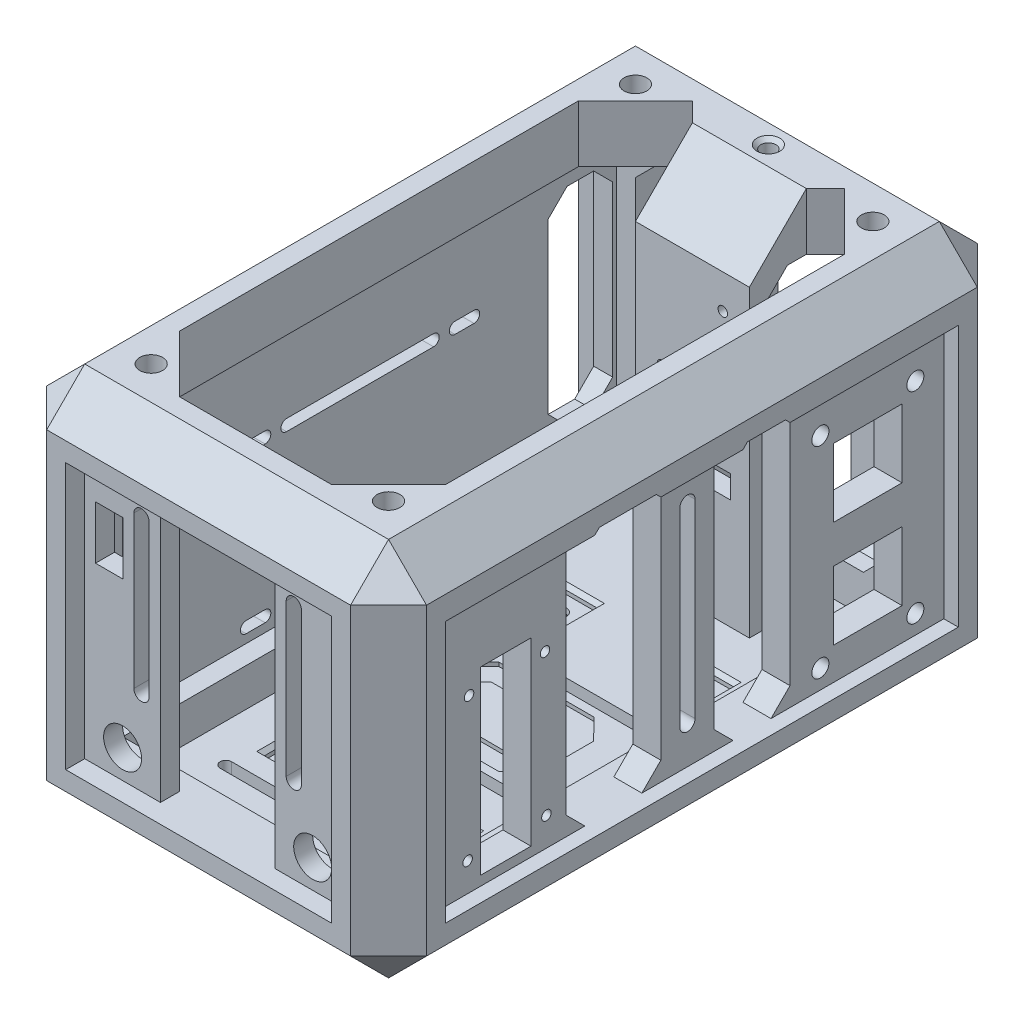
from build123d import *

# Parameters (mm, degrees)
SKETCH1_W                                      = 100
SKETCH1_H                                      = 100
MAIN_CUBE_DEPTH                                = 165
MAIN_CUBE_CHAMFER_SIZE                         = 10
SKETCH2_W                                      = 135
SKETCH2_H                                      = 70
MAIN_CUBE_HOLLOW_OUT_1_DEPTH                   = 100
MAIN_CUBE_HOLLOW_OUT_2_REACH                   = 219.313
SKETCH3_W                                      = 70
SKETCH3_H                                      = 70
SKETCH4_W                                      = 70
SKETCH4_H                                      = 135
MAIN_CUBE_HOLLOW_OUT_3_DEPTH                   = 100
SKETCH5_W                                      = 70
SKETCH5_H                                      = 135
BOTTOM_DEPTH                                   = 5
SKETCH6_W                                      = 70
SKETCH6_H                                      = 5
CAMERA_AND_TEMP_SENSOR_WALL_DEPTH              = 70
SKETCH7_R                                      = 5
SKETCH7_W                                      = 7.25
SKETCH7_H                                      = 14
CAMERA_AND_EXT_TEMP_SENSOR_THROUGH_HOLE_DEPTH  = 5
SKETCH8_W                                      = 5
SKETCH8_H                                      = 135
ANTENNA_AND_BATTERY_BRACKET_DEPTH              = 70
TOP_CHAMFER_1_SIZE                             = 5
SKETCH9_W                                      = 17
SKETCH9_H                                      = 54.5
ANTENNA_AND_BATTERY_ZIP_TIE_HOLES_DEPTH        = 5
ANTENNA_AND_BATTERY_WIRE_PASS_THROUGHS_SIZE    = 5
TOP_START                                      = -151
TOP_CHAMFER_2_DEPTH                            = 38.5
TOP_START_2                                    = -52.5
TOP_CHAMFER_2_2_DEPTH                          = 38.5
TOP_START_3                                    = -107.5
TOP_CHAMFER_2_3_DEPTH                          = 5.658057903
TOP_START_4                                    = -63.158057903
TOP_CHAMFER_2_4_DEPTH                          = 5.658057903
TOP_START_5                                    = 0.5281
TOP_CHAMFER_2_5_DEPTH                          = 13.4719
TOP_CHAMFER_2_6_DEPTH                          = 137
SKETCH10_W                                     = 7.381360458
SKETCH10_H                                     = 135
SD_CARD_BOARD_AND_PERF_BOARD_WALL_DEPTH        = 70
SKETCH11_R                                     = 1.25
SKETCH11_R_2                                   = 2.25
SKETCH11_W                                     = 13.305927988
SKETCH11_H                                     = 47.5
SKETCH11_W_2                                   = 18
SKETCH11_H_2                                   = 18
SKETCH11_W_3                                   = 25
SKETCH11_H_3                                   = 70
SKETCH11_W_4                                   = 20
SD_CARD_BOARD_AND_PERF_BOARD_THROUGH_HOL_DEPTH = 7.381360457
TOP_CHAMFER_3_SIZE                             = 5
SKETCH13_W                                     = 30
SKETCH13_H                                     = 20
PRESSURE_SENSOR_BRACKET_1_DEPTH                = 10
SKETCH14_W                                     = 30
SKETCH14_H                                     = 5
PRESSURE_SENSOR_BRACKET_2_DEPTH                = 85
SKETCH16_W                                     = 30
SKETCH16_H                                     = 15
PRESSURE_SENSOR_BRACKET_3_DEPTH                = 15
SKETCH17_W                                     = 5
SKETCH17_H                                     = 15
PRESSURE_SENSOR_BRACKET_4_DEPTH                = 20
TOP_CHAMFER_4_SIZE                             = 5
PRESSURE_SENSOR_BRACKET_CHAMFER_SIZE           = 5
TOP_CHAMFER_5_SIZE                             = 10
BOTTOM_CHAMFER_1_SIZE                          = 10
WIRE_START                                     = -30
SKETCH18_R                                     = 5
WIRE_MANAGEMENT_HOLE_DEPTH                     = 30
SKETCH19_R                                     = 1.25
SKETCH19_W                                     = 20
SKETCH19_H                                     = 6
PRESSURE_SENSOR_THROUGH_HOLE_DEPTH             = 5
SKETCH20_W                                     = 7.5
SKETCH20_H                                     = 5.695459185
BOSS_EXTRUDE13_DEPTH                           = 70
BOSS_EXTRUDE14_DEPTH                           = 5.695459185
CHAMFER10_SIZE                                 = 5
CHAMFER11_SIZE                                 = 5
CHAMFER12_SIZE                                 = 5
CHAMFER14_SIZE                                 = 15
CUT_EXTRUDE9_START                             = -15
SKETCH23_R                                     = 2
CUT_EXTRUDE9_DEPTH                             = 100
CHAMFER15_SIZE                                 = 1
SKETCH24_W                                     = 9.5
SKETCH24_H                                     = 9.5
SKETCH24_H_2                                   = 9.25
CUT_EXTRUDE10_DEPTH                            = 2
CHAMFER16_SIZE                                 = 1
SKETCH25_R                                     = 2
CUT_EXTRUDE11_DEPTH                            = 3
SKETCH27_R                                     = 2
CUT_EXTRUDE12_DEPTH                            = 3
SKETCH26_R                                     = 2
CUT_EXTRUDE13_DEPTH                            = 3
CHAMFER17_SIZE                                 = 1.5
CHAMFER18_SIZE                                 = 5
CHAMFER19_SIZE                                 = 5
CUT_EXTRUDE14_DEPTH                            = 5
SKETCH29_R                                     = 3
BOSS_EXTRUDE16_DEPTH                           = 15
CUT_EXTRUDE15_DEPTH                            = 5
CUT_EXTRUDE16_DEPTH                            = 1


with BuildPart() as part:
    # Sketch1 → Main Cube (new body)
    with BuildSketch(Plane.XY):
        with Locations((50, 50)):
            Rectangle(SKETCH1_W, SKETCH1_H)
    extrude(amount=-MAIN_CUBE_DEPTH)

    # Main Cube Chamfer
    main_cube_chamfer_edges = [part.edges().sort_by_distance(p)[0] for p in [
        (100, 50, -165),
        (50, 100, -165),
        (0, 50, -165),
        (50, 100, 0),
        (100, 50, 0),
        (50, 0, 0),
        (0, 50, 0),
        (0, 100, -82.5),
        (100, 100, -82.5),
        (100, 0, -82.5),
        (0, 0, -82.5),
        (50, 0, -165),
    ]]
    chamfer(main_cube_chamfer_edges, length=MAIN_CUBE_CHAMFER_SIZE)

    # Sketch2 → Main Cube Hollow Out 1 (cut)
    with BuildSketch(Plane.ZY):
        with Locations((-82.5, 50)):
            Rectangle(SKETCH2_W, SKETCH2_H)
    extrude(amount=-MAIN_CUBE_HOLLOW_OUT_1_DEPTH, mode=Mode.SUBTRACT)

    # Main Cube Hollow Out 2: up to this face of the body (flat: up to its plane)
    main_cube_hollow_out_2_end = Plane(part.part.faces().sort_by_distance((50, 50, 0))[0])
    # Sketch3 → Main Cube Hollow Out 2 (cut, up to the picked face)
    with BuildSketch(Plane(origin=(0, 0, -165), x_dir=(-1, 0, 0), z_dir=(0, 0, -1)), mode=Mode.PRIVATE) as main_cube_hollow_out_2_sk1:
        with Locations((-50, 50)):
            Rectangle(SKETCH3_W, SKETCH3_H)
    main_cube_hollow_out_2_tool1 = split(extrude(main_cube_hollow_out_2_sk1.sketch, amount=-MAIN_CUBE_HOLLOW_OUT_2_REACH, mode=Mode.PRIVATE), bisect_by=main_cube_hollow_out_2_end, keep=Keep.BOTH, mode=Mode.PRIVATE)
    add(main_cube_hollow_out_2_tool1.solids().sort_by(Axis((50, 50, -165), (0, 0, 1)))[0], mode=Mode.SUBTRACT)

    # Sketch4 → Main Cube Hollow Out 3 (cut)
    with BuildSketch(Plane(origin=(0, 100, 0), x_dir=(1, 0, 0), z_dir=(0, 1, 0))):
        with Locations((50, 82.5)):
            Rectangle(SKETCH4_W, SKETCH4_H)
    extrude(amount=-MAIN_CUBE_HOLLOW_OUT_3_DEPTH, mode=Mode.SUBTRACT)

    # Sketch5 → Bottom (add)
    with BuildSketch(Plane.XZ):
        with Locations((50, -82.5)):
            Rectangle(SKETCH5_W, SKETCH5_H)
    extrude(amount=-BOTTOM_DEPTH)

    # Sketch6 → Camera and Temp Sensor Wall (add)
    with BuildSketch(Plane(origin=(0, 15, 0), x_dir=(1, 0, 0), z_dir=(0, 1, 0))):
        with Locations((50, 7.5)):
            Rectangle(SKETCH6_W, SKETCH6_H)
    extrude(amount=CAMERA_AND_TEMP_SENSOR_WALL_DEPTH)

    # Sketch7 → Camera and Ext. Temp Sensor Through Holes (cut)
    with BuildSketch(Plane.XY.offset(-5)):
        with Locations((24.975, 22.5)):
            Circle(SKETCH7_R)
        with Locations((75.025, 22.5)):
            Circle(SKETCH7_R)
        Polygon((34.95, 30), (34.95, 85), (65.05, 85), (65.05, 30), (65.05, 15), (34.95, 15), align=None)
        with BuildLine():
            Line((31.95, 77.5), (31.95, 37.5))
            ThreePointArc((31.95, 37.5), (29.95, 35.5), (27.95, 37.5))
            Line((27.95, 37.5), (27.95, 77.5))
            ThreePointArc((27.95, 77.5), (29.95, 79.5), (31.95, 77.5))
        make_face()
        with BuildLine():
            Line((72.05, 77.5), (72.05, 37.5))
            ThreePointArc((72.05, 37.5), (70.05, 35.5), (68.05, 37.5))
            Line((68.05, 37.5), (68.05, 77.5))
            ThreePointArc((68.05, 77.5), (70.05, 79.5), (72.05, 77.5))
        make_face()
        with Locations((21.475, 68)):
            Rectangle(SKETCH7_W, SKETCH7_H)
    extrude(amount=-CAMERA_AND_EXT_TEMP_SENSOR_THROUGH_HOLE_DEPTH, mode=Mode.SUBTRACT)

    # Sketch8 → Antenna and Battery Bracket (add)
    with BuildSketch(Plane(origin=(0, 15, 0), x_dir=(1, 0, 0), z_dir=(0, 1, 0))):
        with Locations((7.5, 82.5)):
            Rectangle(SKETCH8_W, SKETCH8_H)
    extrude(amount=ANTENNA_AND_BATTERY_BRACKET_DEPTH)

    # Top Chamfer 1
    top_chamfer_1_edges = [part.edges().sort_by_distance(p)[0] for p in [
        (75.025, 85, -10),
        (24.975, 85, -10),
        (75.025, 85, -5),
        (24.975, 85, -5),
        (65.05, 85, -7.5),
        (34.95, 85, -7.5),
    ]]
    chamfer(top_chamfer_1_edges, length=TOP_CHAMFER_1_SIZE - 0.0001)  # a hair under: the kernel refuses the full size

    # Sketch9 → Antenna and Battery Zip Tie Holes (cut)
    with BuildSketch(Plane.ZY.offset(-5)):
        with Locations((-24.5, 49.75)):
            Rectangle(SKETCH9_W, SKETCH9_H)
        with Locations((-140.5, 49.75)):
            Rectangle(SKETCH9_W, SKETCH9_H)
        with BuildLine():
            Line((-132, 77), (-143.412973925, 77))
            ThreePointArc((-143.412973925, 77), (-144.645857537, 67.929285786), (-136.932233227, 63))
            Line((-136.932233227, 63), (-132, 63))
            Line((-132, 63), (-132, 77))
        make_face()
        with BuildLine():
            ThreePointArc((-28.067766773, 63), (-20.354142463, 67.929285786), (-21.587026075, 77))
            Line((-21.587026075, 77), (-33, 77))
            Line((-33, 77), (-33, 63))
            Line((-33, 63), (-28.067766773, 63))
        make_face()
        with BuildLine():
            Line((-112.5, 84), (-107.5, 84))
            ThreePointArc((-107.5, 84), (-106, 82.5), (-107.5, 81))
            Line((-107.5, 81), (-112.5, 81))
            ThreePointArc((-112.5, 81), (-114, 82.5), (-112.5, 84))
        make_face()
        with BuildLine():
            Line((-52.5, 84), (-57.5, 84))
            ThreePointArc((-57.5, 84), (-59, 82.5), (-57.5, 81))
            Line((-57.5, 81), (-52.5, 81))
            ThreePointArc((-52.5, 81), (-51, 82.5), (-52.5, 84))
        make_face()
        with BuildLine():
            Line((-52.5, 61), (-57.5, 61))
            ThreePointArc((-57.5, 61), (-59, 59.5), (-57.5, 58))
            Line((-57.5, 58), (-52.5, 58))
            ThreePointArc((-52.5, 58), (-51, 59.5), (-52.5, 61))
        make_face()
        with BuildLine():
            Line((-101.841942097, 61), (-63.158057903, 61))
            ThreePointArc((-63.158057903, 61), (-61.658057903, 59.5), (-63.158057903, 58))
            Line((-63.158057903, 58), (-101.841942097, 58))
            ThreePointArc((-101.841942097, 58), (-103.341942097, 59.5), (-101.841942097, 61))
        make_face()
        with BuildLine():
            Line((-107.5, 61), (-112.5, 61))
            ThreePointArc((-112.5, 61), (-114, 59.5), (-112.5, 58))
            Line((-112.5, 58), (-107.5, 58))
            ThreePointArc((-107.5, 58), (-106, 59.5), (-107.5, 61))
        make_face()
        with BuildLine():
            Line((-107.5, 20.25), (-112.5, 20.25))
            ThreePointArc((-112.5, 20.25), (-114, 18.75), (-112.5, 17.25))
            Line((-112.5, 17.25), (-107.5, 17.25))
            ThreePointArc((-107.5, 17.25), (-106, 18.75), (-107.5, 20.25))
        make_face()
        with BuildLine():
            Line((-101.841942097, 20.25), (-63.158057903, 20.25))
            ThreePointArc((-63.158057903, 20.25), (-61.658057903, 18.75), (-63.158057903, 17.25))
            Line((-63.158057903, 17.25), (-101.841942097, 17.25))
            ThreePointArc((-101.841942097, 17.25), (-103.341942097, 18.75), (-101.841942097, 20.25))
        make_face()
        with BuildLine():
            Line((-57.5, 20.25), (-52.5, 20.25))
            ThreePointArc((-52.5, 20.25), (-51, 18.75), (-52.5, 17.25))
            Line((-52.5, 17.25), (-57.5, 17.25))
            ThreePointArc((-57.5, 17.25), (-59, 18.75), (-57.5, 20.25))
        make_face()
        with BuildLine():
            Line((-63.158057903, 84), (-101.841942097, 84))
            ThreePointArc((-101.841942097, 84), (-103.341942097, 82.5), (-101.841942097, 81))
            Line((-101.841942097, 81), (-63.158057903, 81))
            ThreePointArc((-63.158057903, 81), (-61.658057903, 82.5), (-63.158057903, 84))
        make_face()
    extrude(amount=-ANTENNA_AND_BATTERY_ZIP_TIE_HOLES_DEPTH, mode=Mode.SUBTRACT)

    # Antenna And Battery Wire Pass throughs
    antenna_and_battery_wire_pass_throughs_edges = [part.edges().sort_by_distance(p)[0] for p in [
        (7.5, 77, -149),
        (7.5, 22.5, -149),
        (7.5, 22.5, -132),
        (7.5, 77, -132),
        (7.5, 22.5, -33),
        (7.5, 22.5, -16),
        (7.5, 77, -16),
        (7.5, 77, -33),
    ]]
    chamfer(antenna_and_battery_wire_pass_throughs_edges, length=ANTENNA_AND_BATTERY_WIRE_PASS_THROUGHS_SIZE)

    # Top Chamfer 2: read off the stored shape, not the designer's step
    # Top Chamfer 2 outline → Top Chamfer 2 (add)
    with BuildSketch(Plane.XY.offset(TOP_START)):
        Polygon((14, 84), (1, 84), (4, 81), (11, 81), align=None)
    extrude(amount=TOP_CHAMFER_2_DEPTH)

    # Top Chamfer 2 2 outline → Top Chamfer 2 2 (add)
    with BuildSketch(Plane.XY.offset(TOP_START_2)):
        Polygon((14, 84), (1, 84), (4, 81), (11, 81), align=None)
    extrude(amount=TOP_CHAMFER_2_2_DEPTH)

    # Top Chamfer 2 3 outline → Top Chamfer 2 3 (add)
    with BuildSketch(Plane.XY.offset(TOP_START_3)):
        Polygon((14, 84), (1, 84), (4, 81), (11, 81), align=None)
    extrude(amount=TOP_CHAMFER_2_3_DEPTH)

    # Top Chamfer 2 4 outline → Top Chamfer 2 4 (add)
    with BuildSketch(Plane.XY.offset(TOP_START_4)):
        Polygon((14, 84), (1, 84), (4, 81), (11, 81), align=None)
    extrude(amount=TOP_CHAMFER_2_4_DEPTH)

    # Top Chamfer 2 5 outline → Top Chamfer 2 5 (cut)
    with BuildSketch(Plane.YZ.offset(TOP_START_5)):
        with BuildLine():
            ThreePointArc((81, -112.5), (82.5, -114), (84, -112.5))
            Line((84, -112.5), (81, -112.5))
        make_face()
        with BuildLine():
            Line((81, -107.5), (84, -107.5))
            ThreePointArc((84, -107.5), (82.5, -106), (81, -107.5))
        make_face()
        with BuildLine():
            ThreePointArc((81, -101.841942097), (82.5, -103.341942097), (84, -101.841942097))
            Line((84, -101.841942097), (81, -101.841942097))
        make_face()
        with BuildLine():
            Line((81, -63.158057903), (84, -63.158057903))
            ThreePointArc((84, -63.158057903), (82.5, -61.658057903), (81, -63.158057903))
        make_face()
        with BuildLine():
            ThreePointArc((81, -57.5), (82.5, -59), (84, -57.5))
            Line((84, -57.5), (81, -57.5))
        make_face()
        with BuildLine():
            Line((81, -52.5), (84, -52.5))
            ThreePointArc((84, -52.5), (82.5, -51), (81, -52.5))
        make_face()
    extrude(amount=TOP_CHAMFER_2_5_DEPTH, mode=Mode.SUBTRACT)

    # Top Chamfer 2 6 outline → Top Chamfer 2 6 (add)
    with BuildSketch(Plane.XY.offset(TOP_START)):
        Polygon((0, 85), (1, 84), (5, 84), (5, 85), align=None)
        Polygon((5, 81), (4, 81), (5, 80), align=None)
        Polygon((10, 85), (10, 84), (14, 84), (15, 85), align=None)
        Polygon((11, 81), (10, 81), (10, 80), align=None)
    extrude(amount=TOP_CHAMFER_2_6_DEPTH)

    # Sketch10 → SD Card Board and Perf Board Wall (add)
    with BuildSketch(Plane(origin=(0, 15, 0), x_dir=(1, 0, 0), z_dir=(0, 1, 0))):
        with Locations((92.5, 82.5)):
            Rectangle(SKETCH10_W, SKETCH10_H)
    extrude(amount=SD_CARD_BOARD_AND_PERF_BOARD_WALL_DEPTH)

    # Sketch11 → SD Card Board and Perf Board Through Holes (cut)
    with BuildSketch(Plane(origin=(96.190680229, 0, 0), x_dir=(0, 0, -1), z_dir=(1, 0, 0))):
        with Locations((25, 60)):
            Circle(SKETCH11_R)
        with Locations((24.625, 22.5)):
            Circle(SKETCH11_R)
        with Locations((45.375, 22.5)):
            Circle(SKETCH11_R)
        with Locations((45, 60)):
            Circle(SKETCH11_R)
        with Locations((117.5, 73)):
            Circle(SKETCH11_R_2)
        with Locations((142.5, 73)):
            Circle(SKETCH11_R_2)
        with Locations((142.5, 20)):
            Circle(SKETCH11_R_2)
        with Locations((117.5, 20)):
            Circle(SKETCH11_R_2)
        with Locations((34.652963994, 41.25)):
            Rectangle(SKETCH11_W, SKETCH11_H)
        with Locations((130, 60.5)):
            Rectangle(SKETCH11_W_2, SKETCH11_H_2)
        with Locations((130, 32.5)):
            Rectangle(SKETCH11_W_2, SKETCH11_H_2)
        with BuildLine():
            Line((84.5, 75), (84.5, 25))
            ThreePointArc((84.5, 25), (82.5, 23), (80.5, 25))
            Line((80.5, 25), (80.5, 75))
            ThreePointArc((80.5, 75), (82.5, 77), (84.5, 75))
        make_face()
        with Locations((63, 50)):
            Rectangle(SKETCH11_W_3, SKETCH11_H_3)
        with Locations((99.5, 50)):
            Rectangle(SKETCH11_W_4, SKETCH11_H_3)
    extrude(amount=-SD_CARD_BOARD_AND_PERF_BOARD_THROUGH_HOL_DEPTH, mode=Mode.SUBTRACT)

    # Top Chamfer 3
    # the kernel refuses this chamfer: 5 mm, written as the material it adds along each edge
    with BuildSketch(Plane(origin=(96.190680229, 15, -75.5), x_dir=(0, 0, 1), z_dir=(-1, 0, 0)), Plane(origin=(96.190680229, 85, -89.5), x_dir=(0, 0, -1), z_dir=(-1, 0, 0)), Plane(origin=(96.190680229, 85, -50.5), x_dir=(0, 0, -1), z_dir=(-1, 0, 0)), Plane(origin=(96.190680229, 15, -109.5), x_dir=(0, 0, 1), z_dir=(-1, 0, 0))) as top_chamfer_3_piece_1:
        Polygon((TOP_CHAMFER_3_SIZE, 0), (0, TOP_CHAMFER_3_SIZE), (0, 0), align=None)
    extrude(amount=7.381360457)
    with BuildSketch(Plane(origin=(96.190680229, 15, -50.5), x_dir=(0, 0, -1), z_dir=(-1, 0, 0)), Plane(origin=(96.190680229, 85, -109.5), x_dir=(0, 0, 1), z_dir=(-1, 0, 0)), Plane(origin=(96.190680229, 85, -75.5), x_dir=(0, 0, 1), z_dir=(-1, 0, 0)), Plane(origin=(96.190680229, 15, -89.5), x_dir=(0, 0, -1), z_dir=(-1, 0, 0))) as top_chamfer_3_piece_2:
        Polygon((TOP_CHAMFER_3_SIZE, 0), (0, -TOP_CHAMFER_3_SIZE), (0, 0), align=None)
    extrude(amount=7.381360457)
    with BuildSketch(Plane(origin=(96.190680229, 85, -109.5), x_dir=(1, 0, 0), z_dir=(0, 0, -1))) as top_chamfer_3_piece_3_section:
        Polygon((TOP_CHAMFER_3_SIZE, 0), (0, TOP_CHAMFER_3_SIZE), (0, 0), align=None)
    top_chamfer_3_piece_3 = extrude(amount=40.5, mode=Mode.PRIVATE)
    top_chamfer_3_piece_3 = split(top_chamfer_3_piece_3, bisect_by=Plane(origin=(100, 85, -109.5), z_dir=(-1, 0, 0)), keep=Keep.TOP, mode=Mode.PRIVATE)
    add(top_chamfer_3_piece_3)
    with BuildSketch(Plane(origin=(96.190680229, 85, -75.5), x_dir=(1, 0, 0), z_dir=(0, 0, -1))) as top_chamfer_3_piece_4_section:
        Polygon((TOP_CHAMFER_3_SIZE, 0), (0, TOP_CHAMFER_3_SIZE), (0, 0), align=None)
    top_chamfer_3_piece_4 = extrude(amount=14, mode=Mode.PRIVATE)
    top_chamfer_3_piece_4 = split(top_chamfer_3_piece_4, bisect_by=Plane(origin=(100, 85, -75.5), z_dir=(-1, 0, 0)), keep=Keep.TOP, mode=Mode.PRIVATE)
    add(top_chamfer_3_piece_4)
    with BuildSketch(Plane(origin=(96.190680229, 85, -15), x_dir=(1, 0, 0), z_dir=(0, 0, -1))) as top_chamfer_3_piece_5_section:
        Polygon((TOP_CHAMFER_3_SIZE, 0), (0, TOP_CHAMFER_3_SIZE), (0, 0), align=None)
    top_chamfer_3_piece_5 = extrude(amount=35.5, mode=Mode.PRIVATE)
    top_chamfer_3_piece_5 = split(top_chamfer_3_piece_5, bisect_by=Plane(origin=(100, 85, -15), z_dir=(-1, 0, 0)), keep=Keep.TOP, mode=Mode.PRIVATE)
    add(top_chamfer_3_piece_5)
    with BuildSketch(Plane(origin=(88.809319771, 85, -162.85841494), x_dir=(-1, 0, 0), z_dir=(0, 0, 1))) as top_chamfer_3_piece_6_section:
        Polygon((TOP_CHAMFER_3_SIZE, 0), (0, TOP_CHAMFER_3_SIZE), (0, 0), align=None)
    top_chamfer_3_piece_6 = extrude(amount=53.35841494, mode=Mode.PRIVATE)
    top_chamfer_3_piece_6 = split(top_chamfer_3_piece_6, bisect_by=Plane(origin=(85, 85, -162.85841494), z_dir=(1, 0, 0)), keep=Keep.TOP, mode=Mode.PRIVATE)
    add(top_chamfer_3_piece_6)
    with BuildSketch(Plane(origin=(88.809319771, 85, -89.5), x_dir=(-1, 0, 0), z_dir=(0, 0, 1))) as top_chamfer_3_piece_7_section:
        Polygon((TOP_CHAMFER_3_SIZE, 0), (0, TOP_CHAMFER_3_SIZE), (0, 0), align=None)
    top_chamfer_3_piece_7 = extrude(amount=14, mode=Mode.PRIVATE)
    top_chamfer_3_piece_7 = split(top_chamfer_3_piece_7, bisect_by=Plane(origin=(85, 85, -89.5), z_dir=(1, 0, 0)), keep=Keep.TOP, mode=Mode.PRIVATE)
    add(top_chamfer_3_piece_7)
    with BuildSketch(Plane(origin=(88.809319771, 85, -50.5), x_dir=(-1, 0, 0), z_dir=(0, 0, 1))) as top_chamfer_3_piece_8_section:
        Polygon((TOP_CHAMFER_3_SIZE, 0), (0, TOP_CHAMFER_3_SIZE), (0, 0), align=None)
    top_chamfer_3_piece_8 = extrude(amount=48.35841494, mode=Mode.PRIVATE)
    top_chamfer_3_piece_8 = split(top_chamfer_3_piece_8, bisect_by=Plane(origin=(85, 85, -50.5), z_dir=(1, 0, 0)), keep=Keep.TOP, mode=Mode.PRIVATE)
    add(top_chamfer_3_piece_8)
    with BuildSketch(Plane(origin=(109.049095169, 85, -109.5), x_dir=(0, 0, 1), z_dir=(-1, 0, 0))) as top_chamfer_3_piece_9a_section:
        Polygon((TOP_CHAMFER_3_SIZE, 0), (0, -TOP_CHAMFER_3_SIZE), (0, 0), align=None)
    top_chamfer_3_piece_9a = extrude(amount=20.239775397, mode=Mode.PRIVATE)
    top_chamfer_3_piece_9a = split(top_chamfer_3_piece_9a, bisect_by=Plane(origin=(100, 85, -109.5), z_dir=(-1, 0, 0)), keep=Keep.TOP, mode=Mode.PRIVATE)
    top_chamfer_3_piece_9a = split(top_chamfer_3_piece_9a, bisect_by=Plane(origin=(96.190680229, 85, -109.5), z_dir=(1, 0, 0)), keep=Keep.TOP, mode=Mode.PRIVATE)
    with BuildSketch(Plane(origin=(96.190680229, 85, -96.64158506), x_dir=(1, 0, 0), z_dir=(0, 0, -1))) as top_chamfer_3_piece_9b_section:
        Polygon((TOP_CHAMFER_3_SIZE, 0), (0, TOP_CHAMFER_3_SIZE), (0, 0), align=None)
    top_chamfer_3_piece_9b = extrude(amount=53.35841494, mode=Mode.PRIVATE)
    top_chamfer_3_piece_9b = split(top_chamfer_3_piece_9b, bisect_by=Plane(origin=(100, 85, -96.64158506), z_dir=(-1, 0, 0)), keep=Keep.TOP, mode=Mode.PRIVATE)
    top_chamfer_3_piece_9b = split(top_chamfer_3_piece_9b, bisect_by=Plane(origin=(96.190680229, 85, -109.5), z_dir=(0, 0, 1)), keep=Keep.TOP, mode=Mode.PRIVATE)
    top_chamfer_3_piece_9 = top_chamfer_3_piece_9a & top_chamfer_3_piece_9b
    add(top_chamfer_3_piece_9)
    with BuildSketch(Plane(origin=(88.809319771, 85, -150), x_dir=(-1, 0, 0), z_dir=(0, 0, 1))) as top_chamfer_3_piece_10a_section:
        Polygon((TOP_CHAMFER_3_SIZE, 0), (0, TOP_CHAMFER_3_SIZE), (0, 0), align=None)
    top_chamfer_3_piece_10a = extrude(amount=53.35841494, mode=Mode.PRIVATE)
    top_chamfer_3_piece_10a = split(top_chamfer_3_piece_10a, bisect_by=Plane(origin=(85, 85, -150), z_dir=(1, 0, 0)), keep=Keep.TOP, mode=Mode.PRIVATE)
    top_chamfer_3_piece_10a = split(top_chamfer_3_piece_10a, bisect_by=Plane(origin=(88.809319771, 85, -109.5), z_dir=(0, 0, 1)), keep=Keep.TOP, mode=Mode.PRIVATE)
    with BuildSketch(Plane(origin=(96.190680229, 85, -109.5), x_dir=(0, 0, 1), z_dir=(-1, 0, 0))) as top_chamfer_3_piece_10b_section:
        Polygon((TOP_CHAMFER_3_SIZE, 0), (0, -TOP_CHAMFER_3_SIZE), (0, 0), align=None)
    top_chamfer_3_piece_10b = extrude(amount=20.239775397, mode=Mode.PRIVATE)
    top_chamfer_3_piece_10b = split(top_chamfer_3_piece_10b, bisect_by=Plane(origin=(85, 85, -109.5), z_dir=(1, 0, 0)), keep=Keep.TOP, mode=Mode.PRIVATE)
    top_chamfer_3_piece_10b = split(top_chamfer_3_piece_10b, bisect_by=Plane(origin=(88.809319771, 85, -109.5), z_dir=(-1, 0, 0)), keep=Keep.TOP, mode=Mode.PRIVATE)
    top_chamfer_3_piece_10 = top_chamfer_3_piece_10a & top_chamfer_3_piece_10b
    add(top_chamfer_3_piece_10)
    with BuildSketch(Plane(origin=(96.190680229, 85, -75.5), x_dir=(1, 0, 0), z_dir=(0, 0, -1))) as top_chamfer_3_piece_11a_section:
        Polygon((TOP_CHAMFER_3_SIZE, 0), (0, TOP_CHAMFER_3_SIZE), (0, 0), align=None)
    top_chamfer_3_piece_11a = extrude(amount=26.85841494, mode=Mode.PRIVATE)
    top_chamfer_3_piece_11a = split(top_chamfer_3_piece_11a, bisect_by=Plane(origin=(100, 85, -75.5), z_dir=(-1, 0, 0)), keep=Keep.TOP, mode=Mode.PRIVATE)
    top_chamfer_3_piece_11a = split(top_chamfer_3_piece_11a, bisect_by=Plane(origin=(96.190680229, 85, -89.5), z_dir=(0, 0, -1)), keep=Keep.TOP, mode=Mode.PRIVATE)
    with BuildSketch(Plane(origin=(109.049095169, 85, -89.5), x_dir=(0, 0, -1), z_dir=(-1, 0, 0))) as top_chamfer_3_piece_11b_section:
        Polygon((TOP_CHAMFER_3_SIZE, 0), (0, TOP_CHAMFER_3_SIZE), (0, 0), align=None)
    top_chamfer_3_piece_11b = extrude(amount=20.239775397, mode=Mode.PRIVATE)
    top_chamfer_3_piece_11b = split(top_chamfer_3_piece_11b, bisect_by=Plane(origin=(100, 85, -89.5), z_dir=(-1, 0, 0)), keep=Keep.TOP, mode=Mode.PRIVATE)
    top_chamfer_3_piece_11b = split(top_chamfer_3_piece_11b, bisect_by=Plane(origin=(96.190680229, 85, -89.5), z_dir=(1, 0, 0)), keep=Keep.TOP, mode=Mode.PRIVATE)
    top_chamfer_3_piece_11 = top_chamfer_3_piece_11a & top_chamfer_3_piece_11b
    add(top_chamfer_3_piece_11)
    with BuildSketch(Plane(origin=(88.809319771, 85, -102.35841494), x_dir=(-1, 0, 0), z_dir=(0, 0, 1))) as top_chamfer_3_piece_12a_section:
        Polygon((TOP_CHAMFER_3_SIZE, 0), (0, TOP_CHAMFER_3_SIZE), (0, 0), align=None)
    top_chamfer_3_piece_12a = extrude(amount=26.85841494, mode=Mode.PRIVATE)
    top_chamfer_3_piece_12a = split(top_chamfer_3_piece_12a, bisect_by=Plane(origin=(85, 85, -102.35841494), z_dir=(1, 0, 0)), keep=Keep.TOP, mode=Mode.PRIVATE)
    top_chamfer_3_piece_12a = split(top_chamfer_3_piece_12a, bisect_by=Plane(origin=(88.809319771, 85, -89.5), z_dir=(0, 0, -1)), keep=Keep.TOP, mode=Mode.PRIVATE)
    with BuildSketch(Plane(origin=(96.190680229, 85, -89.5), x_dir=(0, 0, -1), z_dir=(-1, 0, 0))) as top_chamfer_3_piece_12b_section:
        Polygon((TOP_CHAMFER_3_SIZE, 0), (0, TOP_CHAMFER_3_SIZE), (0, 0), align=None)
    top_chamfer_3_piece_12b = extrude(amount=20.239775397, mode=Mode.PRIVATE)
    top_chamfer_3_piece_12b = split(top_chamfer_3_piece_12b, bisect_by=Plane(origin=(85, 85, -89.5), z_dir=(1, 0, 0)), keep=Keep.TOP, mode=Mode.PRIVATE)
    top_chamfer_3_piece_12b = split(top_chamfer_3_piece_12b, bisect_by=Plane(origin=(88.809319771, 85, -89.5), z_dir=(-1, 0, 0)), keep=Keep.TOP, mode=Mode.PRIVATE)
    top_chamfer_3_piece_12 = top_chamfer_3_piece_12a & top_chamfer_3_piece_12b
    add(top_chamfer_3_piece_12)
    with BuildSketch(Plane(origin=(109.049095169, 85, -75.5), x_dir=(0, 0, 1), z_dir=(-1, 0, 0))) as top_chamfer_3_piece_13a_section:
        Polygon((TOP_CHAMFER_3_SIZE, 0), (0, -TOP_CHAMFER_3_SIZE), (0, 0), align=None)
    top_chamfer_3_piece_13a = extrude(amount=20.239775397, mode=Mode.PRIVATE)
    top_chamfer_3_piece_13a = split(top_chamfer_3_piece_13a, bisect_by=Plane(origin=(100, 85, -75.5), z_dir=(-1, 0, 0)), keep=Keep.TOP, mode=Mode.PRIVATE)
    top_chamfer_3_piece_13a = split(top_chamfer_3_piece_13a, bisect_by=Plane(origin=(96.190680229, 85, -75.5), z_dir=(1, 0, 0)), keep=Keep.TOP, mode=Mode.PRIVATE)
    with BuildSketch(Plane(origin=(96.190680229, 85, -62.64158506), x_dir=(1, 0, 0), z_dir=(0, 0, -1))) as top_chamfer_3_piece_13b_section:
        Polygon((TOP_CHAMFER_3_SIZE, 0), (0, TOP_CHAMFER_3_SIZE), (0, 0), align=None)
    top_chamfer_3_piece_13b = extrude(amount=26.85841494, mode=Mode.PRIVATE)
    top_chamfer_3_piece_13b = split(top_chamfer_3_piece_13b, bisect_by=Plane(origin=(100, 85, -62.64158506), z_dir=(-1, 0, 0)), keep=Keep.TOP, mode=Mode.PRIVATE)
    top_chamfer_3_piece_13b = split(top_chamfer_3_piece_13b, bisect_by=Plane(origin=(96.190680229, 85, -75.5), z_dir=(0, 0, 1)), keep=Keep.TOP, mode=Mode.PRIVATE)
    top_chamfer_3_piece_13 = top_chamfer_3_piece_13a & top_chamfer_3_piece_13b
    add(top_chamfer_3_piece_13)
    with BuildSketch(Plane(origin=(88.809319771, 85, -89.5), x_dir=(-1, 0, 0), z_dir=(0, 0, 1))) as top_chamfer_3_piece_14a_section:
        Polygon((TOP_CHAMFER_3_SIZE, 0), (0, TOP_CHAMFER_3_SIZE), (0, 0), align=None)
    top_chamfer_3_piece_14a = extrude(amount=26.85841494, mode=Mode.PRIVATE)
    top_chamfer_3_piece_14a = split(top_chamfer_3_piece_14a, bisect_by=Plane(origin=(85, 85, -89.5), z_dir=(1, 0, 0)), keep=Keep.TOP, mode=Mode.PRIVATE)
    top_chamfer_3_piece_14a = split(top_chamfer_3_piece_14a, bisect_by=Plane(origin=(88.809319771, 85, -75.5), z_dir=(0, 0, 1)), keep=Keep.TOP, mode=Mode.PRIVATE)
    with BuildSketch(Plane(origin=(96.190680229, 85, -75.5), x_dir=(0, 0, 1), z_dir=(-1, 0, 0))) as top_chamfer_3_piece_14b_section:
        Polygon((TOP_CHAMFER_3_SIZE, 0), (0, -TOP_CHAMFER_3_SIZE), (0, 0), align=None)
    top_chamfer_3_piece_14b = extrude(amount=20.239775397, mode=Mode.PRIVATE)
    top_chamfer_3_piece_14b = split(top_chamfer_3_piece_14b, bisect_by=Plane(origin=(85, 85, -75.5), z_dir=(1, 0, 0)), keep=Keep.TOP, mode=Mode.PRIVATE)
    top_chamfer_3_piece_14b = split(top_chamfer_3_piece_14b, bisect_by=Plane(origin=(88.809319771, 85, -75.5), z_dir=(-1, 0, 0)), keep=Keep.TOP, mode=Mode.PRIVATE)
    top_chamfer_3_piece_14 = top_chamfer_3_piece_14a & top_chamfer_3_piece_14b
    add(top_chamfer_3_piece_14)
    with BuildSketch(Plane(origin=(96.190680229, 85, -15), x_dir=(1, 0, 0), z_dir=(0, 0, -1))) as top_chamfer_3_piece_15a_section:
        Polygon((TOP_CHAMFER_3_SIZE, 0), (0, TOP_CHAMFER_3_SIZE), (0, 0), align=None)
    top_chamfer_3_piece_15a = extrude(amount=48.35841494, mode=Mode.PRIVATE)
    top_chamfer_3_piece_15a = split(top_chamfer_3_piece_15a, bisect_by=Plane(origin=(100, 85, -15), z_dir=(-1, 0, 0)), keep=Keep.TOP, mode=Mode.PRIVATE)
    top_chamfer_3_piece_15a = split(top_chamfer_3_piece_15a, bisect_by=Plane(origin=(96.190680229, 85, -50.5), z_dir=(0, 0, -1)), keep=Keep.TOP, mode=Mode.PRIVATE)
    with BuildSketch(Plane(origin=(109.049095169, 85, -50.5), x_dir=(0, 0, -1), z_dir=(-1, 0, 0))) as top_chamfer_3_piece_15b_section:
        Polygon((TOP_CHAMFER_3_SIZE, 0), (0, TOP_CHAMFER_3_SIZE), (0, 0), align=None)
    top_chamfer_3_piece_15b = extrude(amount=20.239775397, mode=Mode.PRIVATE)
    top_chamfer_3_piece_15b = split(top_chamfer_3_piece_15b, bisect_by=Plane(origin=(100, 85, -50.5), z_dir=(-1, 0, 0)), keep=Keep.TOP, mode=Mode.PRIVATE)
    top_chamfer_3_piece_15b = split(top_chamfer_3_piece_15b, bisect_by=Plane(origin=(96.190680229, 85, -50.5), z_dir=(1, 0, 0)), keep=Keep.TOP, mode=Mode.PRIVATE)
    top_chamfer_3_piece_15 = top_chamfer_3_piece_15a & top_chamfer_3_piece_15b
    add(top_chamfer_3_piece_15)
    with BuildSketch(Plane(origin=(96.190680229, 85, -50.5), x_dir=(0, 0, -1), z_dir=(-1, 0, 0))) as top_chamfer_3_piece_16a_section:
        Polygon((TOP_CHAMFER_3_SIZE, 0), (0, TOP_CHAMFER_3_SIZE), (0, 0), align=None)
    top_chamfer_3_piece_16a = extrude(amount=20.239775397, mode=Mode.PRIVATE)
    top_chamfer_3_piece_16a = split(top_chamfer_3_piece_16a, bisect_by=Plane(origin=(85, 85, -50.5), z_dir=(1, 0, 0)), keep=Keep.TOP, mode=Mode.PRIVATE)
    top_chamfer_3_piece_16a = split(top_chamfer_3_piece_16a, bisect_by=Plane(origin=(88.809319771, 85, -50.5), z_dir=(-1, 0, 0)), keep=Keep.TOP, mode=Mode.PRIVATE)
    with BuildSketch(Plane(origin=(88.809319771, 85, -63.35841494), x_dir=(-1, 0, 0), z_dir=(0, 0, 1))) as top_chamfer_3_piece_16b_section:
        Polygon((TOP_CHAMFER_3_SIZE, 0), (0, TOP_CHAMFER_3_SIZE), (0, 0), align=None)
    top_chamfer_3_piece_16b = extrude(amount=48.35841494, mode=Mode.PRIVATE)
    top_chamfer_3_piece_16b = split(top_chamfer_3_piece_16b, bisect_by=Plane(origin=(85, 85, -63.35841494), z_dir=(1, 0, 0)), keep=Keep.TOP, mode=Mode.PRIVATE)
    top_chamfer_3_piece_16b = split(top_chamfer_3_piece_16b, bisect_by=Plane(origin=(88.809319771, 85, -50.5), z_dir=(0, 0, -1)), keep=Keep.TOP, mode=Mode.PRIVATE)
    top_chamfer_3_piece_16 = top_chamfer_3_piece_16a & top_chamfer_3_piece_16b
    add(top_chamfer_3_piece_16)

    # Sketch13 → Pressure Sensor Bracket 1 (add)
    with BuildSketch(Plane(origin=(0, 5, 0), x_dir=(1, 0, 0), z_dir=(0, 1, 0))):
        with Locations((50, 140)):
            Rectangle(SKETCH13_W, SKETCH13_H)
    extrude(amount=PRESSURE_SENSOR_BRACKET_1_DEPTH)

    # Sketch14 → Pressure Sensor Bracket 2 (add)
    with BuildSketch(Plane(origin=(0, 15, 0), x_dir=(1, 0, 0), z_dir=(0, 1, 0))):
        with Locations((50, 132.5)):
            Rectangle(SKETCH14_W, SKETCH14_H)
    extrude(amount=PRESSURE_SENSOR_BRACKET_2_DEPTH)

    # Sketch16 → Pressure Sensor Bracket 3 (add)
    with BuildSketch(Plane(origin=(0, 100, 0), x_dir=(1, 0, 0), z_dir=(0, 1, 0))):
        with Locations((50, 142.5)):
            Rectangle(SKETCH16_W, SKETCH16_H)
    extrude(amount=-PRESSURE_SENSOR_BRACKET_3_DEPTH)

    # Sketch17 → Pressure Sensor Bracket 4 (add)
    with BuildSketch(Plane(origin=(0, 15, 0), x_dir=(1, 0, 0), z_dir=(0, 1, 0))):
        with Locations((62.5, 142.5)):
            Rectangle(SKETCH17_W, SKETCH17_H)
        with Locations((37.5, 142.5)):
            Rectangle(SKETCH17_W, SKETCH17_H)
    extrude(amount=PRESSURE_SENSOR_BRACKET_4_DEPTH)

    # Top Chamfer 4
    top_chamfer_4_edges = [part.edges().sort_by_distance(p)[0] for p in [
        (50, 85, -135),
    ]]
    chamfer(top_chamfer_4_edges, length=TOP_CHAMFER_4_SIZE)

    # Pressure Sensor Bracket Chamfer
    pressure_sensor_bracket_chamfer_edges = [part.edges().sort_by_distance(p)[0] for p in [
        (62.5, 35, -150),
        (62.5, 35, -135),
        (37.5, 35, -135),
        (37.5, 35, -150),
    ]]
    chamfer(pressure_sensor_bracket_chamfer_edges, length=PRESSURE_SENSOR_BRACKET_CHAMFER_SIZE)

    # Top Chamfer 5
    # the kernel refuses this chamfer: 10 mm, written as the material it adds along each edge
    with BuildSketch(Plane(origin=(85, 85, -150), x_dir=(0, -1, 0), z_dir=(0, 0, -1)), Plane(origin=(15, 85, -165), x_dir=(0, -1, 0), z_dir=(0, 0, 1))) as top_chamfer_5_piece_1:
        Polygon((TOP_CHAMFER_5_SIZE, 0), (0, TOP_CHAMFER_5_SIZE), (0, 0), align=None)
    extrude(amount=15)

    # Bottom Chamfer 1
    # the kernel refuses this chamfer: 10 mm, written as the material it adds along each edge
    with BuildSketch(Plane(origin=(15, 15, -165), x_dir=(1, 0, 0), z_dir=(0, 0, 1))) as bottom_chamfer_1_piece_1:
        Polygon((BOTTOM_CHAMFER_1_SIZE, 0), (0, BOTTOM_CHAMFER_1_SIZE), (0, 0), align=None)
    extrude(amount=15)
    with BuildSketch(Plane(origin=(85, 15, -165), x_dir=(-1, 0, 0), z_dir=(0, 0, 1))) as bottom_chamfer_1_piece_2:
        Polygon((BOTTOM_CHAMFER_1_SIZE, 0), (0, -BOTTOM_CHAMFER_1_SIZE), (0, 0), align=None)
    extrude(amount=15)

    # Sketch18 → Wire Management Hole (cut)
    with BuildSketch(Plane.ZY.offset(-35).offset(WIRE_START)):
        with Locations((-140, 22.5)):
            Circle(SKETCH18_R)
    extrude(amount=WIRE_MANAGEMENT_HOLE_DEPTH, mode=Mode.SUBTRACT)

    # Sketch19 → Pressure Sensor Through Hole (cut)
    with BuildSketch(Plane(origin=(0, 0, -135), x_dir=(-1, 0, 0), z_dir=(0, 0, -1))):
        with Locations((-56.35, 48)):
            Circle(SKETCH19_R)
        with Locations((-43.65, 48)):
            Circle(SKETCH19_R)
        with Locations((-50, 37)):
            Rectangle(SKETCH19_W, SKETCH19_H)
    extrude(amount=-PRESSURE_SENSOR_THROUGH_HOLE_DEPTH, mode=Mode.SUBTRACT)

    # Sketch20 → Boss-Extrude13 (add)
    with BuildSketch(Plane(origin=(0, 15, 0), x_dir=(1, 0, 0), z_dir=(0, 1, 0))):
        with Locations((66.25, 162.152270407)):
            Rectangle(SKETCH20_W, SKETCH20_H)
        with Locations((33.75, 162.152270407)):
            Rectangle(SKETCH20_W, SKETCH20_H)
    extrude(amount=BOSS_EXTRUDE13_DEPTH)

    # Sketch21 → Boss-Extrude14 (add)
    with BuildSketch(Plane(origin=(0, 0, -165), x_dir=(-1, 0, 0), z_dir=(0, 0, -1))):
        Polygon((-15, 25), (-30, 25), (-30, 15), (-25, 15), align=None)
        Polygon((-85, 25), (-70, 25), (-70, 15), (-75.025, 15), align=None)
    extrude(amount=-BOSS_EXTRUDE14_DEPTH)

    # Chamfer10
    chamfer10_edges = [part.edges().sort_by_distance(p)[0] for p in [
        (66.25, 15, -159.304540815),
        (33.75, 15, -159.304540815),
    ]]
    chamfer(chamfer10_edges, length=CHAMFER10_SIZE)

    # Chamfer11
    chamfer11_edges = [part.edges().sort_by_distance(p)[0] for p in [
        (62.5, 15, -159.652270408),
        (37.5, 15, -159.652270408),
    ]]
    chamfer(chamfer11_edges, length=CHAMFER11_SIZE)

    # Chamfer12
    chamfer12_edges = [part.edges().sort_by_distance(p)[0] for p in [
        (62.5, 85, -162.152270408),
        (37.5, 85, -162.152270408),
    ]]
    chamfer(chamfer12_edges, length=CHAMFER12_SIZE)

    # Chamfer14
    chamfer14_edges = [part.edges().sort_by_distance(p)[0] for p in [
        (50, 100, -130),
    ]]
    chamfer(chamfer14_edges, length=CHAMFER14_SIZE)

    # Sketch23 → Cut-Extrude9 (cut)
    with BuildSketch(Plane(origin=(0, 15, 0), x_dir=(1, 0, 0), z_dir=(0, 1, 0)).offset(CUT_EXTRUDE9_START)):
        with Locations(Location((50, 150, 0), (0, 0, 90))):
            Circle(SKETCH23_R)
    extrude(amount=CUT_EXTRUDE9_DEPTH, mode=Mode.SUBTRACT)

    # Chamfer15
    chamfer15_edges = [part.edges().sort_by_distance(p)[0] for p in [
        (50, 0, -148),
        (50, 15, -148),
        (50, 100, -148),
    ]]
    chamfer(chamfer15_edges, length=CHAMFER15_SIZE)

    # Sketch24 → Cut-Extrude10 (cut)
    with BuildSketch(Plane(origin=(0, 5, 0), x_dir=(1, 0, 0), z_dir=(0, 1, 0))):
        Polygon((73, 107.814601259), (72.5, 107.814601259), (72.5, 117.314601259), (63, 117.314601259), (63, 117.814601259), (73, 117.814601259), align=None)
        with Locations((67.75, 112.564601259)):
            Rectangle(SKETCH24_W, SKETCH24_H)
        Polygon((27, 117.814601259), (27, 107.814601259), (27.5, 107.814601259), (27.5, 117.314601259), (37, 117.314601259), (37, 117.814601259), align=None)
        with Locations((32.25, 112.564601259)):
            Rectangle(SKETCH24_W, SKETCH24_H)
        Polygon((27, 50.314601259), (27.5, 50.314601259), (27.5, 40.814601259), (37, 40.814601259), (37, 40.314601259), (27, 40.314601259), align=None)
        with Locations((32.25, 45.564601259)):
            Rectangle(SKETCH24_W, SKETCH24_H)
        with Locations((67.75, 45.439601259)):
            Rectangle(SKETCH24_W, SKETCH24_H_2)
        Polygon((63, 40.314601259), (63, 40.814601259), (72.5, 40.814601259), (72.5, 50.064601259), (73, 50.064601259), (73, 40.314601259), align=None)
    extrude(amount=-CUT_EXTRUDE10_DEPTH, mode=Mode.SUBTRACT)

    # Chamfer16
    chamfer16_edges = [part.edges().sort_by_distance(p)[0] for p in [
        (63, 5, -45.189601259),
        (73, 5, -45.189601259),
        (68, 5, -40.314601259),
        (68, 5, -50.064601259),
        (37, 5, -45.314601259),
        (32, 5, -40.314601259),
        (27, 5, -45.314601259),
        (32, 5, -50.314601259),
        (32, 5, -107.814601259),
        (37, 5, -112.814601259),
        (32, 5, -117.814601259),
        (27, 5, -112.814601259),
        (63, 5, -112.814601259),
        (68, 5, -117.814601259),
        (73, 5, -112.814601259),
        (68, 5, -107.814601259),
    ]]
    chamfer(chamfer16_edges, length=CHAMFER16_SIZE)

    # Sketch25 → Cut-Extrude11 (cut)
    with BuildSketch(Plane(origin=(0, 3, 0), x_dir=(1, 0, 0), z_dir=(0, 1, 0))):
        with Locations(Location((68, 112.814601259, 0), (0, 0, 270))):
            Circle(SKETCH25_R)
    extrude(amount=-CUT_EXTRUDE11_DEPTH, mode=Mode.SUBTRACT)

    # Sketch27 → Cut-Extrude12 (cut)
    with BuildSketch(Plane(origin=(0, 3, 0), x_dir=(1, 0, 0), z_dir=(0, 1, 0))):
        with Locations(Location((32, 45.314601259, 0), (0, 0, 270))):
            Circle(SKETCH27_R)
        with Locations(Location((68, 45.189601259, 0), (0, 0, 270))):
            Circle(SKETCH27_R)
    extrude(amount=-CUT_EXTRUDE12_DEPTH, mode=Mode.SUBTRACT)

    # Sketch26 → Cut-Extrude13 (cut)
    with BuildSketch(Plane(origin=(0, 3, 0), x_dir=(1, 0, 0), z_dir=(0, 1, 0))):
        with Locations(Location((32, 112.814601259, 0), (0, 0, 270))):
            Circle(SKETCH26_R)
    extrude(amount=-CUT_EXTRUDE13_DEPTH, mode=Mode.SUBTRACT)

    # Chamfer17
    chamfer17_edges = [part.edges().sort_by_distance(p)[0] for p in [
        (68, 0, -114.814601259),
        (32, 0, -47.314601259),
        (68, 0, -47.189601259),
        (32, 0, -114.814601259),
    ]]
    chamfer(chamfer17_edges, length=CHAMFER17_SIZE)

    # Chamfer18
    chamfer18_edges = [part.edges().sort_by_distance(p)[0] for p in [
        (63.75, 85, -159.304540815),
        (36.25, 85, -159.304540815),
    ]]
    chamfer(chamfer18_edges, length=CHAMFER18_SIZE)

    # Chamfer19
    chamfer19_edges = [part.edges().sort_by_distance(p)[0] for p in [
        (65, 92.5, -150),
        (35, 92.5, -150),
    ]]
    chamfer(chamfer19_edges, length=CHAMFER19_SIZE)

    # Sketch28 → Cut-Extrude14 (cut)
    with BuildSketch(Plane(origin=(0, 0, -135), x_dir=(-1, 0, 0), z_dir=(0, 0, -1))):
        with BuildLine():
            ThreePointArc((-58, 74.75), (-57.116116524, 75.116116524), (-56.75, 76))
            Line((-56.75, 76), (-58, 76))
            Line((-58, 76), (-58, 74.75))
        make_face()
        with BuildLine():
            Line((-58, 76), (-56.75, 76))
            ThreePointArc((-56.75, 76), (-58.883883476, 76.883883476), (-58, 74.75))
            Line((-58, 74.75), (-58, 76))
        make_face()
        with BuildLine():
            ThreePointArc((-47, 53.18), (-45.232233047, 53.912233047), (-44.5, 55.68))
            Line((-44.5, 55.68), (-58, 55.68))
            Line((-58, 55.68), (-58, 58.18))
            Line((-58, 58.18), (-60, 58.18))
            ThreePointArc((-60, 58.18), (-62.5, 55.68), (-60, 53.18))
            Line((-60, 53.18), (-47, 53.18))
        make_face()
        with BuildLine():
            Line((-58, 55.68), (-44.5, 55.68))
            ThreePointArc((-44.5, 55.68), (-45.232233047, 57.447766953), (-47, 58.18))
            Line((-47, 58.18), (-58, 58.18))
            Line((-58, 58.18), (-58, 55.68))
        make_face()
        with BuildLine():
            Line((-42, 56.93), (-42, 55.68))
            Line((-42, 55.68), (-43.25, 55.68))
            ThreePointArc((-43.25, 55.68), (-42, 54.43), (-40.75, 55.68))
            ThreePointArc((-40.75, 55.68), (-41.116116524, 56.563883476), (-42, 56.93))
        make_face()
        with BuildLine():
            Line((-43.25, 55.68), (-42, 55.68))
            Line((-42, 55.68), (-42, 56.93))
            ThreePointArc((-42, 56.93), (-42.883883476, 56.563883476), (-43.25, 55.68))
        make_face()
    extrude(amount=-CUT_EXTRUDE14_DEPTH, mode=Mode.SUBTRACT)

    # Sketch29 → Boss-Extrude16 (add)
    # profile 1 of 4: a face of its own
    with BuildSketch(Plane(origin=(0, 100, 0), x_dir=(1, 0, 0), z_dir=(0, 1, 0))):
        Polygon((15, 30), (30, 15), (15, 15), align=None)
        with Locations(Location((18.75, 18.75, 0), (0, 0, 270))):
            Circle(SKETCH29_R, mode=Mode.SUBTRACT)
    # profile 2 of 4: a face of its own
    with BuildSketch(Plane(origin=(0, 100, 0), x_dir=(1, 0, 0), z_dir=(0, 1, 0))):
        Polygon((85, 30), (70, 15), (85, 15), align=None)
        with Locations(Location((81.25, 18.75, 0), (0, 0, 270))):
            Circle(SKETCH29_R, mode=Mode.SUBTRACT)
    # profile 3 of 4: a face of its own
    with BuildSketch(Plane(origin=(0, 100, 0), x_dir=(1, 0, 0), z_dir=(0, 1, 0))):
        Polygon((85, 135), (70, 150), (85, 150), align=None)
        with Locations(Location((81.25, 146.25, 0), (0, 0, 270))):
            Circle(SKETCH29_R, mode=Mode.SUBTRACT)
    # profile 4 of 4: a face of its own
    with BuildSketch(Plane(origin=(0, 100, 0), x_dir=(1, 0, 0), z_dir=(0, 1, 0))):
        Polygon((15, 135), (30, 150), (15, 150), align=None)
        with Locations(Location((18.75, 146.25, 0), (0, 0, 270))):
            Circle(SKETCH29_R, mode=Mode.SUBTRACT)
    extrude(amount=-BOSS_EXTRUDE16_DEPTH)

    # Sketch31 → Cut-Extrude15 (cut)
    with BuildSketch(Plane(origin=(0, 5, 0), x_dir=(1, 0, 0), z_dir=(0, 1, 0))):
        with BuildLine():
            Line((25, 23.657300629), (75, 23.657300629))
            ThreePointArc((75, 23.657300629), (76.5, 22.157300629), (75, 20.657300629))
            Line((75, 20.657300629), (25, 20.657300629))
            ThreePointArc((25, 20.657300629), (23.5, 22.157300629), (25, 23.657300629))
        make_face()
        with BuildLine():
            Line((25, 33.657300629), (75, 33.657300629))
            ThreePointArc((75, 33.657300629), (76.5, 32.157300629), (75, 30.657300629))
            Line((75, 30.657300629), (25, 30.657300629))
            ThreePointArc((25, 30.657300629), (23.5, 32.157300629), (25, 33.657300629))
        make_face()
        with BuildLine():
            Line((25, 64.314601259), (75, 64.314601259))
            ThreePointArc((75, 64.314601259), (76.5, 62.814601259), (75, 61.314601259))
            Line((75, 61.314601259), (25, 61.314601259))
            ThreePointArc((25, 61.314601259), (23.5, 62.814601259), (25, 64.314601259))
        make_face()
        with BuildLine():
            Line((25, 96.814601259), (75, 96.814601259))
            ThreePointArc((75, 96.814601259), (76.5, 95.314601259), (75, 93.814601259))
            Line((75, 93.814601259), (25, 93.814601259))
            ThreePointArc((25, 93.814601259), (23.5, 95.314601259), (25, 96.814601259))
        make_face()
    extrude(amount=-CUT_EXTRUDE15_DEPTH, mode=Mode.SUBTRACT)

    # Sketch32 → Cut-Extrude16 (cut)
    with BuildSketch(Plane(origin=(0, 5, 0), x_dir=(1, 0, 0), z_dir=(0, 1, 0))):
        Polygon((32, 79.064601259), (32, 86.002101259), (37.531428571, 91.53352983), (62.531428571, 91.53352983), (68, 86.002101259), (68, 79.002101259), (68, 72.002101259), (62.531428571, 66.595672687), (37.531428571, 66.595672687), (32, 72.127101259), align=None)
        Polygon((40.984526708, 72.095904985), (37.531428571, 75.549003122), (37.531428571, 82.549003122), (40.984526708, 86.002101259), (59.098118478, 86.002101259), (62.531428571, 82.52932783), (62.531428571, 75.466457689), (59.058655143, 72.033147595), align=None, mode=Mode.SUBTRACT)
    extrude(amount=-CUT_EXTRUDE16_DEPTH, mode=Mode.SUBTRACT)


solid = part.part
